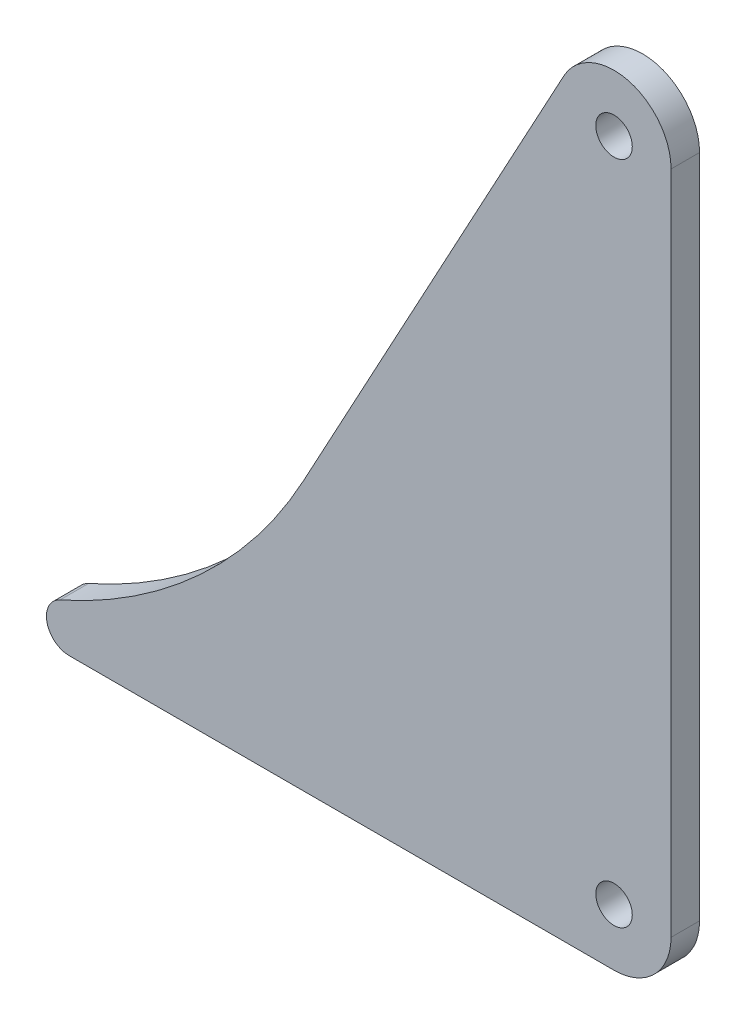
from build123d import *

# Parameters (mm, degrees)
BOSS_EXTRUDE1_DEPTH = 3.175
FILLET1_R           = 2.54
FILLET2_R           = 6.35
SKETCH2_R           = 2.032
CUT_EXTRUDE1_DEPTH  = 112.28418263


with BuildPart() as part:
    # Sketch1 → Boss-Extrude1 (new body)
    with BuildSketch(Plane.XY):
        with BuildLine():
            Line((0, 0), (0, 105.51708787))
            Line((0, 105.51708787), (-40.936420529, 29.917929588))
            ThreePointArc((-40.936420529, 29.917929588), (-60.96443539, 8.620384617), (-88.9, 0))
            Line((-88.9, 0), (0, 0))
        make_face()
    extrude(amount=BOSS_EXTRUDE1_DEPTH)

    # Fillet1
    fillet1_edges = [part.edges().sort_by_distance(p)[0] for p in [
        (-88.9, 0, 1.5875),
    ]]
    fillet(fillet1_edges, radius=FILLET1_R)

    # Fillet2
    fillet2_edges = [part.edges().sort_by_distance(p)[0] for p in [
        (0, 0, 1.5875),
        (0, 105.51708787, 1.5875),
    ]]
    fillet(fillet2_edges, radius=FILLET2_R)

    # Sketch2 → Cut-Extrude1 (cut, through all)
    with BuildSketch(Plane.XY.offset(3.175)):
        with Locations((-6.35, 6.35)):
            Circle(SKETCH2_R)
        with Locations((-6.35, 80.45454267)):
            Circle(SKETCH2_R)
    extrude(amount=-CUT_EXTRUDE1_DEPTH, mode=Mode.SUBTRACT)


solid = part.part
